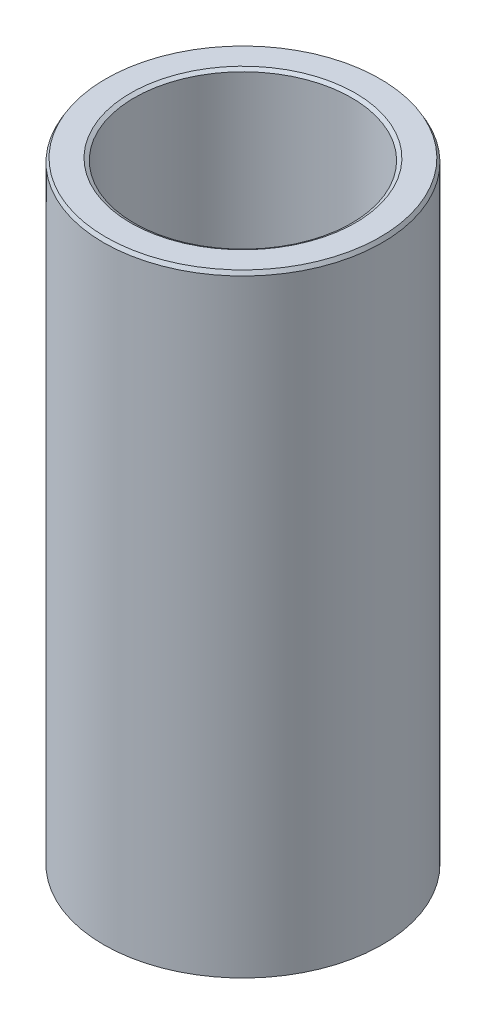
from build123d import *
from OCP.BRepFilletAPI import BRepFilletAPI_MakeChamfer

# Parameters (mm, degrees)
SKETCH1_R           = 60
BOSS_EXTRUDE1_DEPTH = 264.404737895
SKETCH2_R           = 46.805397736
CUT_EXTRUDE1_DEPTH  = 278.686631693
CHAMFER1_SIZE       = 1.61433297
CHAMFER1_SIZE2      = 0.932035575


with BuildPart() as part:
    # Sketch1 → Boss-Extrude1 (new body)
    with BuildSketch(Plane(origin=(0, 0, 0), x_dir=(1, 0, 0), z_dir=(0, 1, 0))):
        Circle(SKETCH1_R)
    extrude(amount=BOSS_EXTRUDE1_DEPTH)

    # Sketch2 → Cut-Extrude1 (cut, through all)
    with BuildSketch(Plane(origin=(0, 0, 0), x_dir=(1, 0, 0), z_dir=(0, 1, 0))):
        Circle(SKETCH2_R)
    extrude(amount=CUT_EXTRUDE1_DEPTH, mode=Mode.SUBTRACT)

    # Chamfer1: one chamfer whose edges measure the first distance from different faces: ONE call of the kernel's chamfer builder (chamfer() names one face for all edges)
    chamfer1_edges_1 = [part.edges().sort_by_distance(p)[0] for p in [
        (-46.805397736, 264.404737895, 0),
    ]]
    chamfer1_side_1 = [part.faces().sort_by_distance(p)[0] for p in [
        (-58.302943725, 264.404737895, 0),
    ]]
    chamfer1_edges_2 = [part.edges().sort_by_distance(p)[0] for p in [
        (-46.805397736, 0, 0),
    ]]
    chamfer1_side_2 = [part.faces().sort_by_distance(p)[0] for p in [
        (-46.805397736, 132.202368947, 0),
    ]]
    chamfer1_edges_3 = [part.edges().sort_by_distance(p)[0] for p in [
        (-60, 0, 0),
    ]]
    chamfer1_side_3 = [part.faces().sort_by_distance(p)[0] for p in [
        (-58.302943725, 0, 0),
    ]]
    chamfer1_edges_4 = [part.edges().sort_by_distance(p)[0] for p in [
        (-60, 264.404737895, 0),
    ]]
    chamfer1_side_4 = [part.faces().sort_by_distance(p)[0] for p in [
        (-60, 132.202368947, 0),
    ]]
    chamfer1 = BRepFilletAPI_MakeChamfer(part.part.solid().wrapped)
    for e in chamfer1_edges_1:
        chamfer1.Add(CHAMFER1_SIZE, CHAMFER1_SIZE2, e.wrapped, chamfer1_side_1[0].wrapped)  # the first distance lies on this face
    for e in chamfer1_edges_2:
        chamfer1.Add(CHAMFER1_SIZE, CHAMFER1_SIZE2, e.wrapped, chamfer1_side_2[0].wrapped)  # the first distance lies on this face
    for e in chamfer1_edges_3:
        chamfer1.Add(CHAMFER1_SIZE, CHAMFER1_SIZE2, e.wrapped, chamfer1_side_3[0].wrapped)  # the first distance lies on this face
    for e in chamfer1_edges_4:
        chamfer1.Add(CHAMFER1_SIZE, CHAMFER1_SIZE2, e.wrapped, chamfer1_side_4[0].wrapped)  # the first distance lies on this face
    add(Compound.cast(chamfer1.Shape()), mode=Mode.REPLACE)


solid = part.part
